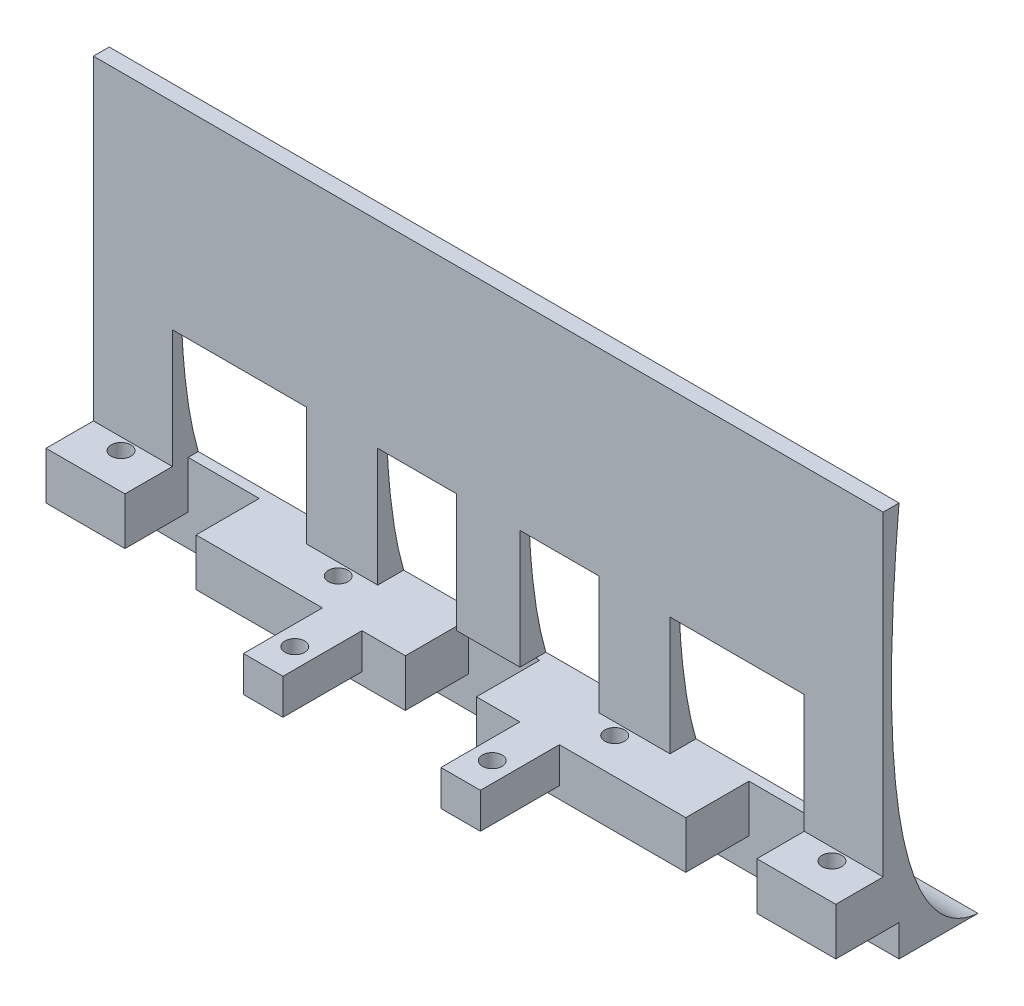
from build123d import *

# Parameters (mm, degrees)
SZKIC1_W                         = 100
SZKIC1_H                         = 28
OGOLNY_KSZTALT_DEPTH             = 50
ZAKRZYWUIENIE_OUTSIDE_W          = 53.052
ZAKRZYWUIENIE_OUTSIDE_H          = 75.052
WYCIECIE_KSZTAL_PRZOD_DEPTH      = 105
WYCIECIE_KSZTALTU_TYL_DEPTH      = 23
WYCIECIE_KSZTALTU_TYL_DEPTH_BACK = 99.5
SZKIC4_W                         = 35
SZKIC4_H                         = 10
SZKIC5_W                         = 30
SZKIC5_H                         = 10
PODBICIE_TYL_SPOD_DEPTH          = 5.5
SZKIC6_W                         = 100
SZKIC6_H                         = 8
PODBICIE_SRODEK_SPOD_DEPTH       = 4
PRZYCIECIE_OD_GORY_DEPTH         = 40
OTWORY_NA_SRUBY_DEPTH            = 90
OTWORY_NA_SRUBY_DEPTH_BACK       = 71
SZKIC8_R                         = 1.25
SZKIC9_W                         = 9
SZKIC9_H                         = 10
KTIR_KABLE_DEPTH                 = 10
WYTNIJ_WYCI_GNI_CIE3_DEPTH       = 84
WYTNIJ_WYCI_GNI_CIE3_DEPTH_BACK  = 81
SZKIC10_W                        = 20
SZKIC10_H                        = 10
WYTNIJ_WYCI_GNI_CIE4_DEPTH       = 59
WYTNIJ_WYCI_GNI_CIE4_DEPTH_BACK  = 55
SZKIC11_W                        = 10
SZKIC11_H                        = 15
SZKIC11_W_2                      = 17


with BuildPart() as part:
    # Szkic1 → ogolny ksztalt (new body)
    with BuildSketch(Plane(origin=(0, 0, 0), x_dir=(1, 0, 0), z_dir=(0, 1, 0))):
        with Locations((-50, 14)):
            Rectangle(SZKIC1_W, SZKIC1_H)
    extrude(amount=OGOLNY_KSZTALT_DEPTH)

    # zakrzywuienie outside → wyciecie ksztal przod (cut)
    with BuildSketch(Plane(origin=(0, 0, 0), x_dir=(0, 0, -1), z_dir=(1, 0, 0))):
        with Locations((14, 25)):
            Rectangle(ZAKRZYWUIENIE_OUTSIDE_W, ZAKRZYWUIENIE_OUTSIDE_H)
        with BuildLine():
            Line((28, 0), (18, 0))
            Line((18, 0), (0, 0))
            Line((0, 0), (0, 50))
            Line((0, 50), (18, 50))
            add(Edge.make_bspline(
                [(18, 50), (14.693585387, 12.992576306), (20.397077092, 0.692779903), (28, 0)],
                knots=[0, 0, 0, 0, 1, 1, 1, 1], degree=3))
        make_face(mode=Mode.SUBTRACT)
    extrude(amount=-WYCIECIE_KSZTAL_PRZOD_DEPTH, mode=Mode.SUBTRACT)

    # Szkic4 → wyciecie ksztaltu tyl (cut, two sides: drawn at the far end of the back side and taken through both)
    with BuildSketch(Plane(origin=(0, 0, 0), x_dir=(-1, 0, 0), z_dir=(0, -1, 0)).offset(-WYCIECIE_KSZTALTU_TYL_DEPTH_BACK)):
        with Locations((17.5, 5)):
            Rectangle(SZKIC4_W, SZKIC4_H)
        with Locations((82.5, 5)):
            Rectangle(SZKIC4_W, SZKIC4_H)
    extrude(amount=WYCIECIE_KSZTALTU_TYL_DEPTH + WYCIECIE_KSZTALTU_TYL_DEPTH_BACK, mode=Mode.SUBTRACT)

    # Szkic5 → podbicie tyl(spod) (cut)
    with BuildSketch(Plane(origin=(0, 0, 0), x_dir=(-1, 0, 0), z_dir=(0, -1, 0))):
        with Locations((50, 5)):
            Rectangle(SZKIC5_W, SZKIC5_H)
    extrude(amount=-PODBICIE_TYL_SPOD_DEPTH, mode=Mode.SUBTRACT)

    # Szkic6 → podbicie srodek(spod) (cut)
    with BuildSketch(Plane(origin=(0, 0, 0), x_dir=(-1, 0, 0), z_dir=(0, -1, 0))):
        with Locations((50, 14)):
            Rectangle(SZKIC6_W, SZKIC6_H)
    extrude(amount=-PODBICIE_SRODEK_SPOD_DEPTH, mode=Mode.SUBTRACT)

    # Szkic7 → przyciecie od gory (cut)
    with BuildSketch(Plane(origin=(0, 50, 0), x_dir=(1, 0, 0), z_dir=(0, 1, 0))):
        Polygon((0, 10), (-35, 10), (-35, 0), (-65, 0), (-65, 10), (-100, 10), (-100, 16), (0, 16), align=None)
    extrude(amount=-PRZYCIECIE_OD_GORY_DEPTH, mode=Mode.SUBTRACT)

    # Szkic8 → otwory na sruby (cut, two sides: drawn at the far end of the back side and taken through both)
    with BuildSketch(Plane(origin=(0, 5.5, 0), x_dir=(-1, 0, 0), z_dir=(0, -1, 0)).offset(-OTWORY_NA_SRUBY_DEPTH_BACK)):
        with Locations((62.5, 4)):
            Circle(SZKIC8_R)
        with Locations((37.5, 4)):
            Circle(SZKIC8_R)
        with Locations((67.5, 14.5)):
            Circle(SZKIC8_R)
        with Locations((32.5, 14.5)):
            Circle(SZKIC8_R)
        with Locations((95, 14.5)):
            Circle(SZKIC8_R)
        with Locations((5, 14.5)):
            Circle(SZKIC8_R)
    extrude(amount=OTWORY_NA_SRUBY_DEPTH + OTWORY_NA_SRUBY_DEPTH_BACK, mode=Mode.SUBTRACT)

    # Szkic9 → ktir kable (cut)
    with BuildSketch(Plane(origin=(0, 0, 0), x_dir=(-1, 0, 0), z_dir=(0, -1, 0))):
        with Locations((50, 13)):
            Rectangle(SZKIC9_W, SZKIC9_H)
        with Locations((14.5, 13)):
            Rectangle(SZKIC9_W, SZKIC9_H)
        with Locations((85.5, 13)):
            Rectangle(SZKIC9_W, SZKIC9_H)
    extrude(amount=-KTIR_KABLE_DEPTH, mode=Mode.SUBTRACT)

    # Szkic10 → Wytnij-wyciągnięcie3 (cut, two sides: drawn at the far end of the back side and taken through both)
    with BuildSketch(Plane.XZ.offset(-5.5).offset(-WYTNIJ_WYCI_GNI_CIE3_DEPTH_BACK)):
        with Locations((-50, -5)):
            Rectangle(SZKIC10_W, SZKIC10_H)
    extrude(amount=WYTNIJ_WYCI_GNI_CIE3_DEPTH + WYTNIJ_WYCI_GNI_CIE3_DEPTH_BACK, mode=Mode.SUBTRACT)

    # Szkic11 → Wytnij-wyciągnięcie4 (cut, two sides: drawn at the far end of the back side and taken through both)
    with BuildSketch(Plane.XY.offset(-16).offset(-WYTNIJ_WYCI_GNI_CIE4_DEPTH_BACK)):
        with Locations((-59, 17.5)):
            Rectangle(SZKIC11_W, SZKIC11_H)
        with Locations((-41, 17.5)):
            Rectangle(SZKIC11_W, SZKIC11_H)
        with Locations((-81.5, 17.5)):
            Rectangle(SZKIC11_W_2, SZKIC11_H)
        with Locations((-18.5, 17.5)):
            Rectangle(SZKIC11_W_2, SZKIC11_H)
    extrude(amount=WYTNIJ_WYCI_GNI_CIE4_DEPTH + WYTNIJ_WYCI_GNI_CIE4_DEPTH_BACK, mode=Mode.SUBTRACT)


solid = part.part
